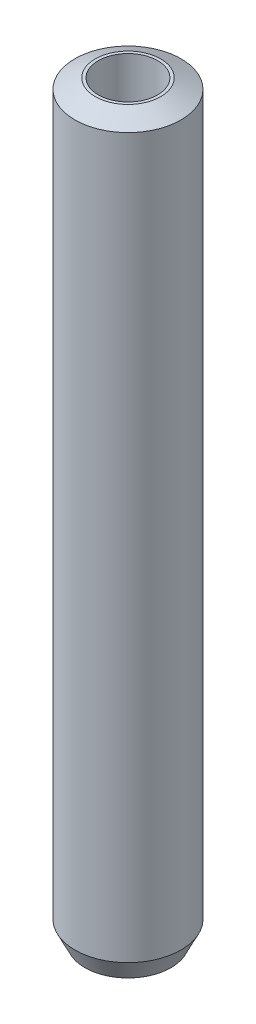
from build123d import *
from OCP.BRepFilletAPI import BRepFilletAPI_MakeChamfer

# Parameters (mm, degrees)
SKETCH1_R           = 15
BOSS_EXTRUDE1_DEPTH = 211.831143882
SKETCH2_R           = 8.392891656
CUT_EXTRUDE1_DEPTH  = 213.890660947
CHAMFER1_SIZE       = 2.826992918
CHAMFER1_SIZE2      = 5.750346454


with BuildPart() as part:
    # Sketch1 → Boss-Extrude1 (new body)
    with BuildSketch(Plane(origin=(0, 0, 0), x_dir=(1, 0, 0), z_dir=(0, 1, 0))):
        Circle(SKETCH1_R)
    extrude(amount=BOSS_EXTRUDE1_DEPTH)

    # Sketch2 → Cut-Extrude1 (cut, through all)
    with BuildSketch(Plane(origin=(0, 0, 0), x_dir=(1, 0, 0), z_dir=(0, 1, 0))):
        Circle(SKETCH2_R)
    extrude(amount=CUT_EXTRUDE1_DEPTH, mode=Mode.SUBTRACT)

    # Chamfer1: one chamfer whose edges measure the first distance from different faces: ONE call of the kernel's chamfer builder (chamfer() names one face for all edges)
    chamfer1_edges_1 = [part.edges().sort_by_distance(p)[0] for p in [
        (-15, 211.831143882, 0),
    ]]
    chamfer1_side_1 = [part.faces().sort_by_distance(p)[0] for p in [
        (-15, 105.915571941, 0),
    ]]
    chamfer1_edges_2 = [part.edges().sort_by_distance(p)[0] for p in [
        (-15, 0, 0),
    ]]
    chamfer1_side_2 = [part.faces().sort_by_distance(p)[0] for p in [
        (-14.575735931, 0, 0),
    ]]
    chamfer1 = BRepFilletAPI_MakeChamfer(part.part.solid().wrapped)
    for e in chamfer1_edges_1:
        chamfer1.Add(CHAMFER1_SIZE, CHAMFER1_SIZE2, e.wrapped, chamfer1_side_1[0].wrapped)  # the first distance lies on this face
    for e in chamfer1_edges_2:
        chamfer1.Add(CHAMFER1_SIZE, CHAMFER1_SIZE2, e.wrapped, chamfer1_side_2[0].wrapped)  # the first distance lies on this face
    add(Compound.cast(chamfer1.Shape()), mode=Mode.REPLACE)


solid = part.part
